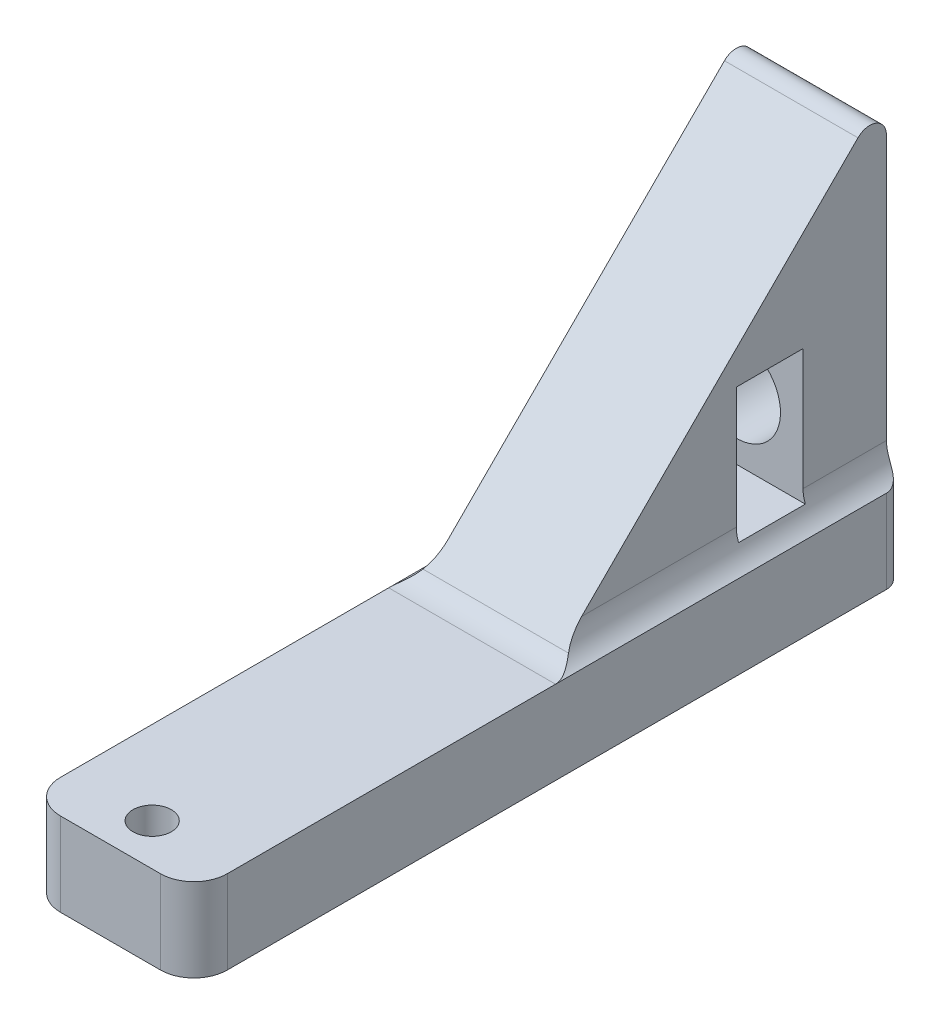
from build123d import *

# Parameters (mm, degrees)
SKETCH2_W                = 10
SKETCH2_H                = 42.5
SKETCH2_R                = 1.15
BOSS_EXTRUDE1_DEPTH      = 5
BOSS_EXTRUDE2_DEPTH      = 4
BOSS_EXTRUDE2_DEPTH_BACK = 4
SKETCH4_R                = 2.65
CUT_EXTRUDE1_DEPTH       = 12
SKETCH5_W                = 4
SKETCH5_H                = 8
CUT_EXTRUDE2_DEPTH       = 51.122350304
FILLET1_R                = 2
FILLET2_R                = 1


# Some blends are built 0.0001 mm under size
with BuildPart() as part:
    # Sketch2 → Boss-Extrude1 (new body)
    with BuildSketch(Plane(origin=(0, 0, 0), x_dir=(1, 0, 0), z_dir=(0, 1, 0))):
        with Locations((5, -21.25)):
            Rectangle(SKETCH2_W, SKETCH2_H)
        with Locations(Location((5, -40, 0), (0, 0, 270))):
            Circle(SKETCH2_R, mode=Mode.SUBTRACT)
    extrude(amount=BOSS_EXTRUDE1_DEPTH)

    # Sketch3 → Boss-Extrude2 (add, two sides: drawn at the far end of the back side and taken through both)
    with BuildSketch(Plane(origin=(5, 0, 0), x_dir=(0, 0, -1), z_dir=(1, 0, 0)).offset(-BOSS_EXTRUDE2_DEPTH_BACK)):
        Polygon((0, 5), (-20, 5), (0, 25), align=None)
    extrude(amount=BOSS_EXTRUDE2_DEPTH + BOSS_EXTRUDE2_DEPTH_BACK)

    # Sketch4 → Cut-Extrude1 (cut)
    with BuildSketch(Plane(origin=(0, 0, 0), x_dir=(-1, 0, 0), z_dir=(0, 0, -1))):
        with Locations((-5, 10)):
            Circle(SKETCH4_R)
    extrude(amount=-CUT_EXTRUDE1_DEPTH, mode=Mode.SUBTRACT)

    # Sketch5 → Cut-Extrude2 (cut, through all)
    with BuildSketch(Plane(origin=(9, 0, 0), x_dir=(0, 0, -1), z_dir=(1, 0, 0))):
        with Locations((-7, 10)):
            Rectangle(SKETCH5_W, SKETCH5_H)
    extrude(amount=-CUT_EXTRUDE2_DEPTH, mode=Mode.SUBTRACT)

    # Fillet1
    # the kernel refuses this fillet: 2 mm, written as the material it adds along each edge
    with BuildSketch(Plane(origin=(1, 5, 0), x_dir=(-1, 0, 0), z_dir=(0, 0, 1))) as fillet1_piece_1_section:
        with BuildLine():
            CenterArc((2, -1.732050808), FILLET1_R, 120, 60)
            Line((0, -1.732050808), (0, 0))
            Line((0, 0), (1, 0))
        make_face()
    fillet1_piece_1 = extrude(amount=24.330127019, mode=Mode.PRIVATE)
    fillet1_piece_1 = split(fillet1_piece_1, bisect_by=Plane(origin=(1, 15, 10), z_dir=(0, -0.7071067811865475, -0.7071067811865476)), keep=Keep.TOP, mode=Mode.PRIVATE)
    fillet1_piece_1 = split(fillet1_piece_1, bisect_by=Plane(origin=(1, 6, 0), z_dir=(0, -1, 0)), keep=Keep.TOP, mode=Mode.PRIVATE)
    add(fillet1_piece_1)
    with BuildSketch(Plane(origin=(1, 5, 0), x_dir=(-1, 0, 0), z_dir=(0, 0, 1))) as fillet1_piece_2_section:
        with BuildLine():
            CenterArc((2, -1.732050808), FILLET1_R, 120, 60)
            Line((0, -1.732050808), (0, 0))
            Line((0, 0), (1, 0))
        make_face()
    fillet1_piece_2 = extrude(amount=24.330127019, mode=Mode.PRIVATE)
    fillet1_piece_2 = split(fillet1_piece_2, bisect_by=Plane(origin=(1, 5, 5), z_dir=(0, 0, -1)), keep=Keep.TOP, mode=Mode.PRIVATE)
    add(fillet1_piece_2)
    with BuildSketch(Plane(origin=(1, 5, -4.330127019), x_dir=(-1, 0, 0), z_dir=(0, 0, 1))) as fillet1_piece_3_section:
        with BuildLine():
            CenterArc((2, -1.732050808), FILLET1_R, 120, 60)
            Line((0, -1.732050808), (0, 0))
            Line((0, 0), (1, 0))
        make_face()
    fillet1_piece_3 = extrude(amount=28.660254038, mode=Mode.PRIVATE)
    fillet1_piece_3 = split(fillet1_piece_3, bisect_by=Plane(origin=(1, 17.165063509, 7.834936491), z_dir=(0, -0.7071067811865475, -0.7071067811865476)), keep=Keep.TOP, mode=Mode.PRIVATE)
    fillet1_piece_3 = split(fillet1_piece_3, bisect_by=Plane(origin=(1, 5, 9), z_dir=(0, 0, 1)), keep=Keep.TOP, mode=Mode.PRIVATE)
    add(fillet1_piece_3)
    with BuildSketch(Plane(origin=(9, 5, 0), x_dir=(1, 0, 0), z_dir=(0, 0, 1))) as fillet1_piece_4_section:
        with BuildLine():
            CenterArc((2, 1.732050808), FILLET1_R, 180, 60)
            Line((0, 1.732050808), (0, 0))
            Line((0, 0), (1, 0))
        make_face()
    fillet1_piece_4 = extrude(amount=24.330127019, mode=Mode.PRIVATE)
    fillet1_piece_4 = split(fillet1_piece_4, bisect_by=Plane(origin=(9, 15, 10), z_dir=(0, -0.7071067811865475, -0.7071067811865476)), keep=Keep.TOP, mode=Mode.PRIVATE)
    fillet1_piece_4 = split(fillet1_piece_4, bisect_by=Plane(origin=(9, 6, 0), z_dir=(0, -1, 0)), keep=Keep.TOP, mode=Mode.PRIVATE)
    add(fillet1_piece_4)
    with BuildSketch(Plane(origin=(9, 5, 0), x_dir=(1, 0, 0), z_dir=(0, 0, 1))) as fillet1_piece_5_section:
        with BuildLine():
            CenterArc((2, 1.732050808), FILLET1_R, 180, 60)
            Line((0, 1.732050808), (0, 0))
            Line((0, 0), (1, 0))
        make_face()
    fillet1_piece_5 = extrude(amount=24.330127019, mode=Mode.PRIVATE)
    fillet1_piece_5 = split(fillet1_piece_5, bisect_by=Plane(origin=(9, 5, 5), z_dir=(0, 0, -1)), keep=Keep.TOP, mode=Mode.PRIVATE)
    add(fillet1_piece_5)
    with BuildSketch(Plane(origin=(9, 5, -4.330127019), x_dir=(1, 0, 0), z_dir=(0, 0, 1))) as fillet1_piece_6_section:
        with BuildLine():
            CenterArc((2, 1.732050808), FILLET1_R, 180, 60)
            Line((0, 1.732050808), (0, 0))
            Line((0, 0), (1, 0))
        make_face()
    fillet1_piece_6 = extrude(amount=28.660254038, mode=Mode.PRIVATE)
    fillet1_piece_6 = split(fillet1_piece_6, bisect_by=Plane(origin=(9, 17.165063509, 7.834936491), z_dir=(0, -0.7071067811865475, -0.7071067811865476)), keep=Keep.TOP, mode=Mode.PRIVATE)
    fillet1_piece_6 = split(fillet1_piece_6, bisect_by=Plane(origin=(9, 5, 9), z_dir=(0, 0, 1)), keep=Keep.TOP, mode=Mode.PRIVATE)
    add(fillet1_piece_6)
    with BuildSketch(Plane(origin=(9, 5, 20), x_dir=(0, 0, 1), z_dir=(-1, 0, 0))) as fillet1_piece_7:
        with BuildLine():
            CenterArc((FILLET1_R * 0.414213562373, FILLET1_R), FILLET1_R, 225, 45)
            Line((-FILLET1_R * 0.292893218813, FILLET1_R * 0.292893218813), (0, 0))
            Line((0, 0), (FILLET1_R * 0.414213562373, 0))
        make_face()
    extrude(amount=8)
    with BuildSketch(Plane(origin=(9, 5, 20), x_dir=(0, 0, 1), z_dir=(-1, 0, 0))) as fillet1_piece_8a_section:
        with BuildLine():
            CenterArc((FILLET1_R * 0.414213562373, FILLET1_R), FILLET1_R, 225, 45)
            Line((-FILLET1_R * 0.292893218813, FILLET1_R * 0.292893218813), (0, 0))
            Line((0, 0), (FILLET1_R * 0.414213562373, 0))
        make_face()
    fillet1_piece_8a = extrude(amount=10.071067812, mode=Mode.PRIVATE)
    fillet1_piece_8a = split(fillet1_piece_8a, bisect_by=Plane(origin=(0, 5, 20), z_dir=(1, 0, 0)), keep=Keep.TOP, mode=Mode.PRIVATE)
    fillet1_piece_8a = split(fillet1_piece_8a, bisect_by=Plane(origin=(1, 5, 20), z_dir=(-1, 0, 0)), keep=Keep.TOP, mode=Mode.PRIVATE)
    with BuildSketch(Plane(origin=(1, 5, 0), x_dir=(-1, 0, 0), z_dir=(0, 0, 1))) as fillet1_piece_8b_section:
        with BuildLine():
            CenterArc((2, -1.732050808), FILLET1_R, 120, 60)
            Line((0, -1.732050808), (0, 0))
            Line((0, 0), (1, 0))
        make_face()
    fillet1_piece_8b = extrude(amount=24.330127019, mode=Mode.PRIVATE)
    fillet1_piece_8b = split(fillet1_piece_8b, bisect_by=Plane(origin=(1, 15, 10), z_dir=(0, 0.7071067811865475, 0.7071067811865476)), keep=Keep.TOP, mode=Mode.PRIVATE)
    fillet1_piece_8b = split(fillet1_piece_8b, bisect_by=Plane(origin=(1, 6, 0), z_dir=(0, -1, 0)), keep=Keep.TOP, mode=Mode.PRIVATE)
    fillet1_piece_8 = fillet1_piece_8a & fillet1_piece_8b
    add(fillet1_piece_8)
    with BuildSketch(Plane(origin=(9, 5, 0), x_dir=(1, 0, 0), z_dir=(0, 0, 1))) as fillet1_piece_9a_section:
        with BuildLine():
            CenterArc((2, 1.732050808), FILLET1_R, 180, 60)
            Line((0, 1.732050808), (0, 0))
            Line((0, 0), (1, 0))
        make_face()
    fillet1_piece_9a = extrude(amount=24.330127019, mode=Mode.PRIVATE)
    fillet1_piece_9a = split(fillet1_piece_9a, bisect_by=Plane(origin=(9, 15, 10), z_dir=(0, 0.7071067811865475, 0.7071067811865476)), keep=Keep.TOP, mode=Mode.PRIVATE)
    fillet1_piece_9a = split(fillet1_piece_9a, bisect_by=Plane(origin=(9, 6, 0), z_dir=(0, -1, 0)), keep=Keep.TOP, mode=Mode.PRIVATE)
    with BuildSketch(Plane(origin=(11.071067812, 5, 20), x_dir=(0, 0, 1), z_dir=(-1, 0, 0))) as fillet1_piece_9b_section:
        with BuildLine():
            CenterArc((FILLET1_R * 0.414213562373, FILLET1_R), FILLET1_R, 225, 45)
            Line((-FILLET1_R * 0.292893218813, FILLET1_R * 0.292893218813), (0, 0))
            Line((0, 0), (FILLET1_R * 0.414213562373, 0))
        make_face()
    fillet1_piece_9b = extrude(amount=10.071067812, mode=Mode.PRIVATE)
    fillet1_piece_9b = split(fillet1_piece_9b, bisect_by=Plane(origin=(10, 5, 20), z_dir=(-1, 0, 0)), keep=Keep.TOP, mode=Mode.PRIVATE)
    fillet1_piece_9b = split(fillet1_piece_9b, bisect_by=Plane(origin=(9, 5, 20), z_dir=(1, 0, 0)), keep=Keep.TOP, mode=Mode.PRIVATE)
    fillet1_piece_9 = fillet1_piece_9a & fillet1_piece_9b
    add(fillet1_piece_9)
    # the kernel refuses this fillet: 2 mm, written as the material it takes off along each edge
    with BuildSketch(Plane(origin=(0, -5, 42.5), x_dir=(1, 0, 0), z_dir=(0, 1, 0))) as fillet1_2_piece_1:
        with BuildLine():
            CenterArc((FILLET1_R, FILLET1_R), FILLET1_R, 180, 90)
            Line((0, FILLET1_R), (0, 0))
            Line((0, 0), (FILLET1_R, 0))
        make_face()
    extrude(amount=15, mode=Mode.SUBTRACT)
    with BuildSketch(Plane(origin=(10, -5, 42.5), x_dir=(-1, 0, 0), z_dir=(0, 1, 0))) as fillet1_2_piece_2:
        with BuildLine():
            CenterArc((FILLET1_R, -FILLET1_R), FILLET1_R, 90, 90)
            Line((0, -FILLET1_R), (0, 0))
            Line((0, 0), (FILLET1_R, 0))
        make_face()
    extrude(amount=15, mode=Mode.SUBTRACT)

    # Fillet2
    fillet2_edges = [part.edges().sort_by_distance(p)[0] for p in [
        (0, 2.5, 0),
        (10, 2.5, 0),
        (5, 25, 0),
    ]]
    fillet(fillet2_edges, radius=FILLET2_R - 0.0001)  # a hair under: the kernel refuses the full size


solid = part.part
